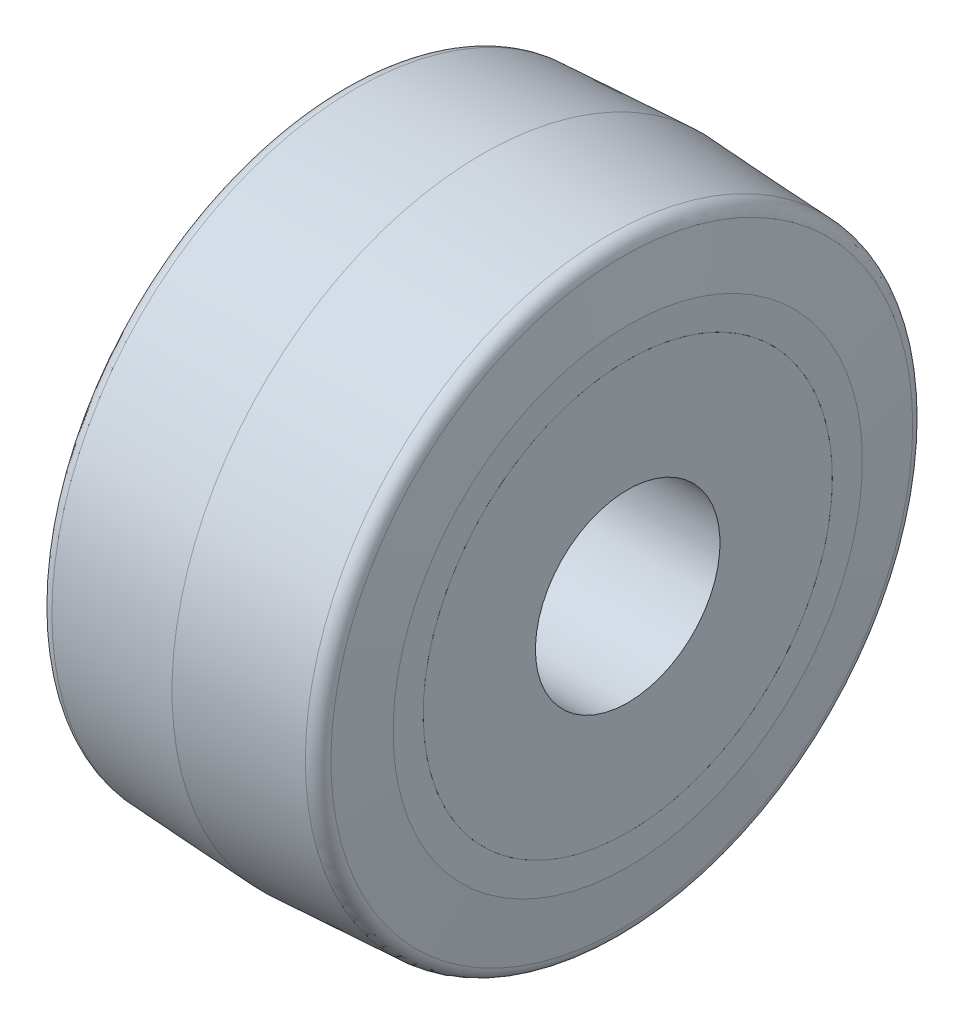
from build123d import *

# Parameters (mm, degrees)
SKETCH3_W          = 17.199413367
SKETCH3_H          = 109.667546616
CUT_EXTRUDE4_DEPTH = 76.2


# Read off the part's stored shape, not the designer's step: Cut-Extrude3
with BuildPart() as part:
    # Sketch1 → Revolve1 (revolve)
    with BuildSketch(Plane.XY, mode=Mode.PRIVATE) as revolve1_sk:
        with BuildLine():
            Line((20.761521884, 49.711934744), (0, 50.8))
            Line((0, 50.8), (-20.761521884, 49.711934744))
            ThreePointArc((-20.761521884, 49.711934744), (-22.215460448, 49.087273439), (-22.915358941, 47.668019694))
            Line((-22.915358941, 47.668019694), (-23.884348631, 38.448698622))
            ThreePointArc((-23.884348631, 38.448698622), (-24.380244956, 37.475447286), (-25.4, 37.084))
            Line((-25.4, 37.084), (-25.4, 33.528))
            Line((-25.4, 33.528), (-19.05, 33.528))
            Line((-19.05, 33.528), (-19.05, 41.148))
            Line((-19.05, 41.148), (19.05, 41.148))
            Line((19.05, 41.148), (19.05, 33.528))
            Line((19.05, 33.528), (25.4, 33.528))
            Line((25.4, 33.528), (25.4, 37.084))
            ThreePointArc((25.4, 37.084), (24.380244956, 37.475447286), (23.884348631, 38.448698622))
            Line((23.884348631, 38.448698622), (22.915358941, 47.668019694))
            ThreePointArc((22.915358941, 47.668019694), (22.215460448, 49.087273439), (20.761521884, 49.711934744))
        make_face()
    revolve(revolve1_sk.sketch.rotate(Axis((-25.4, 0, 0), (1, 0, 0)), 270), axis=Axis((-25.4, 0, 0), (1, 0, 0)))

    # Cut-Extrude3 outline → Cut-Extrude3 (revolve, cut)
    with BuildSketch(Plane.YX):
        with BuildLine():
            Line((38.448698622, -23.884348631), (33.528, -23.884348631))
            Line((33.528, -23.884348631), (33.528, -25.4))
            Line((33.528, -25.4), (37.084, -25.4))
            ThreePointArc((37.084, -25.4), (37.475447286, -24.380244956), (38.448698622, -23.884348631))
        make_face()
    revolve(axis=Axis((0, 0, 0), (1, 0, 0)), mode=Mode.SUBTRACT)


with BuildPart() as body_2:
    # Cut-Extrude3 2 outline → Cut-Extrude3 2 (revolve)
    with BuildSketch(Plane.YX):
        with BuildLine():
            Line((26.416, 27.7749), (15.1257, 27.7749))
            Line((15.1257, 27.7749), (15.1257, -23.884348631))
            Line((15.1257, -23.884348631), (33.528, -23.884348631))
            Line((33.528, -23.884348631), (33.528, -19.05))
            Line((33.528, -19.05), (41.148, -19.05))
            Line((41.148, -19.05), (41.148, 19.05))
            Line((41.148, 19.05), (33.528, 19.05))
            Line((33.528, 19.05), (33.528, 25.4))
            Line((33.528, 25.4), (28.702, 25.4))
            Line((28.702, 25.4), (28.702, 25.4889))
            ThreePointArc((28.702, 25.4889), (28.032446102, 27.105346102), (26.416, 27.7749))
        make_face()
    revolve(axis=Axis((0, 0, 0), (1, 0, 0)))


with BuildPart() as cut_extrude4_tool:
    # Sketch3 → Cut-Extrude4 (new, symmetric)
    with BuildSketch(Plane.XY):
        with Locations((32.484055314, 4.086989315)):
            Rectangle(SKETCH3_W, SKETCH3_H)
    extrude(amount=CUT_EXTRUDE4_DEPTH, both=True)


with BuildPart() as part_1:
    add(part.part)

    # Cut-Extrude4: cut by cut_extrude4_tool
    add(cut_extrude4_tool.part, mode=Mode.SUBTRACT)


with BuildPart() as body_2_1:
    add(body_2.part)

    # Cut-Extrude4: cut by cut_extrude4_tool
    add(cut_extrude4_tool.part, mode=Mode.SUBTRACT)


solid = Compound([part_1.part, body_2_1.part])
